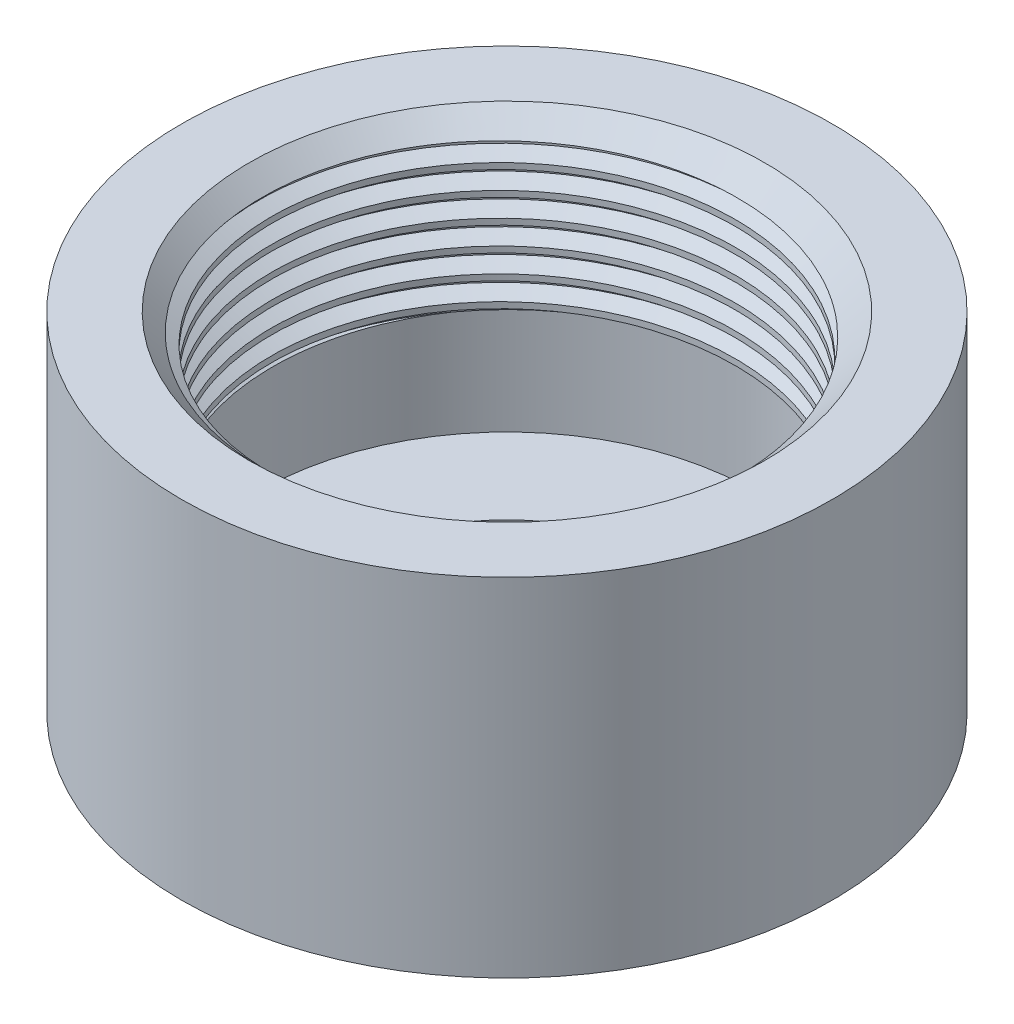
from build123d import *

# Parameters (mm, degrees)
THREAD1_PITCH = 1.411111111


with BuildPart() as part:
    # Sketch1 → Revolve1 (revolve)
    with BuildSketch(Plane.XY, mode=Mode.PRIVATE) as revolve1_sk:
        Polygon((8.255, 0), (19.05, 0), (19.05, 20.32), (15.1003, 20.32), (13.5763, 18.796), (13.5763, 10.287), (14.5415, 10.287), (14.5415, 3.937), (8.255, 3.937), align=None)
    revolve(revolve1_sk.sketch.rotate(Axis((0, 17.608859233, 0), (0, -1, 0)), 90), axis=Axis((0, 17.608859233, 0), (0, -1, 0)))

    # Thread1: the profile of Thread Profile2 profile screwed along a right-hand helix of 12.138661 turns, 8 arcs to a turn; built about Z, then put on its axis
    thread1_z = Axis((0, 0, 0), (0, 0, 1))
    thread1_corners = [(13.576, 0, -0.000173205), (14.34008629, 0, 0.44097222), (14.34008629, 0, 0.617361109), (13.576, 0, 1.058506535)]
    with BuildLine(mode=Mode.PRIVATE) as thread1_profile:
        Line(thread1_corners[0], thread1_corners[1])
        Line(thread1_corners[1], thread1_corners[2])
        Line(thread1_corners[2], thread1_corners[3])
        Line(thread1_corners[3], thread1_corners[0])
    thread1_cap = Face(thread1_profile.wire())
    thread1_turn_angles = [0, 22.5, 45, 67.5, 90, 112.5, 135, 157.5, 180, 202.5, 225, 247.5, 270, 292.5, 315, 337.5, 360]
    thread1_turn_weights = [1, 0.9238795325112867, 1, 0.9238795325112867, 1, 0.9238795325112867, 1, 0.9238795325112867, 1, 0.9238795325112867, 1, 0.9238795325112867, 1, 0.9238795325112867, 1, 0.9238795325112867, 1]
    thread1_turn_rails = [Edge.make_bspline([Vector(p[0], p[1], 0).rotate(thread1_z, thread1_turn_angles[k]) / thread1_turn_weights[k] + Vector(0, 0, p[2] + THREAD1_PITCH * thread1_turn_angles[k] / 360) for k in range(17)], [0, 0, 0, 1, 1, 2, 2, 3, 3, 4, 4, 5, 5, 6, 6, 7, 7, 8, 8, 8], 2, thread1_turn_weights) for p in thread1_corners]
    thread1_turn_sides = [Face.make_surface_from_curves(thread1_turn_rails[p[0]], thread1_turn_rails[p[1]]) for p in [(0, 1), (1, 2), (2, 3), (3, 0)]]
    thread1_last_angles = [4320, 4342.5, 4365, 4367.459055118, 4369.918110236]
    thread1_last_weights = [1, 0.9238795325112867, 1, 0.9990791378967221, 1]
    thread1_last_rails = [Edge.make_bspline([Vector(p[0], p[1], 0).rotate(thread1_z, thread1_last_angles[k]) / thread1_last_weights[k] + Vector(0, 0, p[2] + THREAD1_PITCH * thread1_last_angles[k] / 360) for k in range(5)], [0, 0, 0, 1, 1, 2, 2, 2], 2, thread1_last_weights) for p in thread1_corners]
    thread1_last_sides = [Face.make_surface_from_curves(thread1_last_rails[p[0]], thread1_last_rails[p[1]]) for p in [(0, 1), (1, 2), (2, 3), (3, 0)]]
    thread1 = Plane(origin=(0, 22.336, 0), x_dir=(-1, 0, 0), z_dir=(0, -1, 0)) * Solid(Shell([*[p.moved(Location((0, 0, THREAD1_PITCH * i))) for i in range(12) for p in thread1_turn_sides], *thread1_last_sides, thread1_cap, thread1_cap.rotate(thread1_z, 4369.918110236).moved(Location((0, 0, THREAD1_PITCH * 4369.918110236 / 360)))]))
    add(thread1, mode=Mode.SUBTRACT)


solid = part.part
